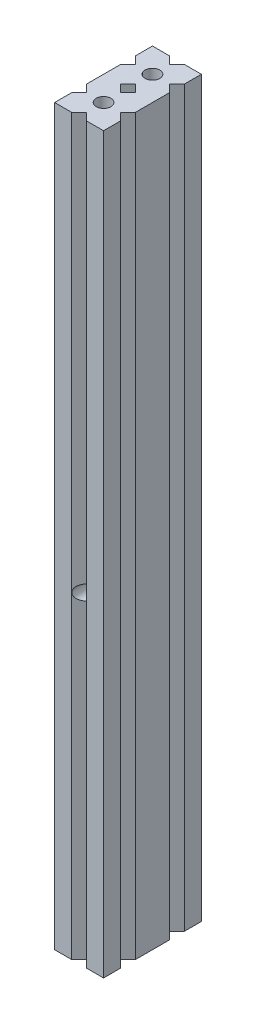
from build123d import *

# Parameters (mm, degrees)
SKIZZE1_W                       = 20
SKIZZE1_H                       = 40
AUFSATZ_LINEAR_AUSTRAGEN1_DEPTH = 300
SCHNITT_LINEAR_AUSTRAGEN1_DEPTH = 304.315017762
SKIZZE3_R                       = 3
SCHNITT_LINEAR_AUSTRAGEN2_DEPTH = 304.315017762
SKETCH1_R                       = 3
EXTRUDE1_DEPTH                  = 40


with BuildPart() as part:
    # Skizze1 → Aufsatz-Linear austragen1 (new body)
    with BuildSketch(Plane(origin=(0, 0, 0), x_dir=(1, 0, 0), z_dir=(0, 1, 0))):
        with Locations((10, 20)):
            Rectangle(SKIZZE1_W, SKIZZE1_H)
    extrude(amount=AUFSATZ_LINEAR_AUSTRAGEN1_DEPTH)

    # Skizze2 → Schnitt-Linear austragen1 (cut, through all)
    with BuildSketch(Plane(origin=(0, 300, 0), x_dir=(1, 0, 0), z_dir=(0, 1, 0))):
        Polygon((13, 40), (7, 40), (10, 37), align=None)
        Polygon((3, 30), (0, 33), (0, 27), align=None)
        Polygon((20, 27), (20, 33), (17, 30), align=None)
        Polygon((3, 10), (0, 13), (0, 7), align=None)
        Polygon((20, 7), (20, 13), (17, 10), align=None)
        Polygon((10, 3), (7, 0), (13, 0), align=None)
        Polygon((10, 23), (7, 20), (10, 17), (13, 20), align=None)
    extrude(amount=-SCHNITT_LINEAR_AUSTRAGEN1_DEPTH, mode=Mode.SUBTRACT)

    # Skizze3 → Schnitt-Linear austragen2 (cut, through all)
    with BuildSketch(Plane.XZ):
        with Locations((10, -10)):
            Circle(SKIZZE3_R)
        with Locations((10, -30)):
            Circle(SKIZZE3_R)
    extrude(amount=-SCHNITT_LINEAR_AUSTRAGEN2_DEPTH, mode=Mode.SUBTRACT)

    # Sketch1 → Extrude1 (cut)
    with BuildSketch(Plane.XY):
        with Locations((10, 130)):
            Circle(SKETCH1_R)
    extrude(amount=-EXTRUDE1_DEPTH, mode=Mode.SUBTRACT)


solid = part.part
